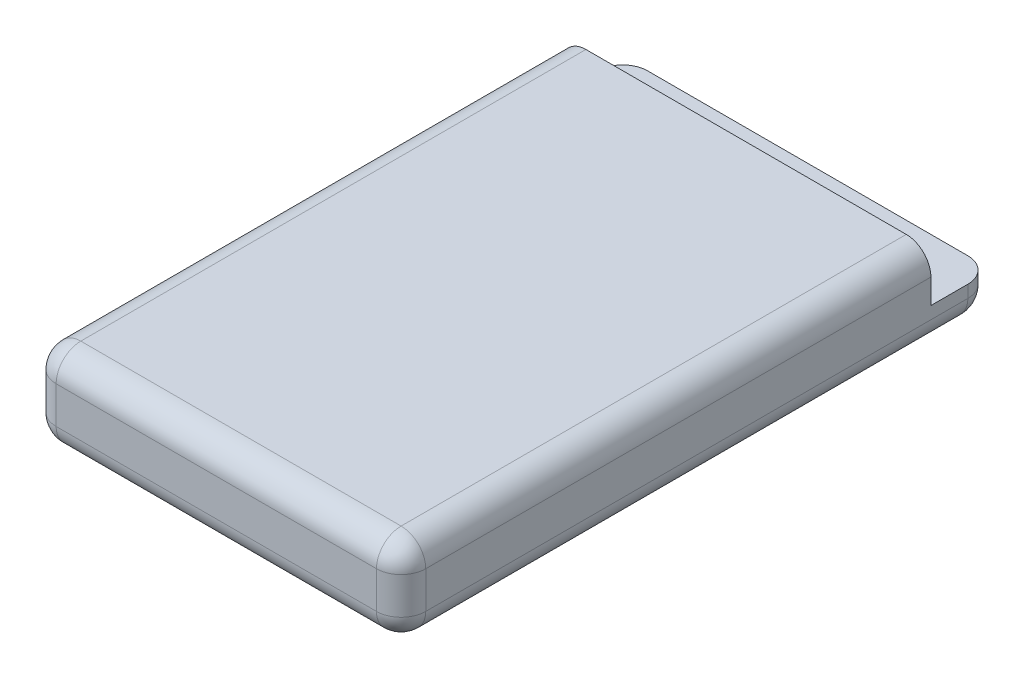
from build123d import *

# Parameters (mm, degrees)
SKETCH_1_W          = 30
SKETCH_1_H          = 48
EXTRUDE_1_DEPTH     = 7
FILLET_1_R          = 2
FILLET_2_R          = 2
SKETCH_2_W          = 26
SKETCH_2_H          = 3
CUT_EXTRUDE_1_DEPTH = 4


with BuildPart() as part:
    # Эскиз1 → Бобышка-Вытянуть1 (new body)
    with BuildSketch(Plane(origin=(0, 0, 0), x_dir=(1, 0, 0), z_dir=(0, 1, 0))):
        Rectangle(SKETCH_1_W, SKETCH_1_H)
    extrude(amount=EXTRUDE_1_DEPTH)

    # Скругление1
    fillet_1_edges = [part.edges().sort_by_distance(p)[0] for p in [
        (-15, 7, 0),
        (0, 7, 24),
        (15, 7, 0),
        (0, 0, 24),
        (-15, 0, 0),
        (0, 0, -24),
        (15, 0, 0),
        (0, 7, -24),
    ]]
    fillet(fillet_1_edges, radius=FILLET_1_R)

    # Скругление2
    # the kernel refuses this fillet: 2 mm, written as the material it takes off along each edge
    with BuildSketch(Plane(origin=(13, 2, 22), x_dir=(1, 0, 0), z_dir=(0, 0, 1))) as fillet_2_piece_1_section:
        Polygon((0, 0), (FILLET_2_R, 0), (FILLET_2_R, -FILLET_2_R), (0, -FILLET_2_R), align=None)
    fillet_2_piece_1 = extrude(amount=FILLET_2_R, mode=Mode.PRIVATE)
    fillet_2_piece_1 = fillet_2_piece_1 - Plane(origin=(13, 2, 22), x_dir=(-0.7071067811865475, 0.7071067811865475, 0), z_dir=(0, 0, 1)) * Sphere(FILLET_2_R, mode=Mode.PRIVATE)
    add(fillet_2_piece_1, mode=Mode.SUBTRACT)
    with BuildSketch(Plane(origin=(-13, 2, 22), x_dir=(-1, 0, 0), z_dir=(0, 0, 1))) as fillet_2_piece_2_section:
        Polygon((0, 0), (FILLET_2_R, 0), (FILLET_2_R, FILLET_2_R), (0, FILLET_2_R), align=None)
    fillet_2_piece_2 = extrude(amount=FILLET_2_R, mode=Mode.PRIVATE)
    fillet_2_piece_2 = fillet_2_piece_2 - Plane(origin=(-13, 2, 22), x_dir=(0.7071067811865475, 0.7071067811865475, 0), z_dir=(0, 0, 1)) * Sphere(FILLET_2_R, mode=Mode.PRIVATE)
    add(fillet_2_piece_2, mode=Mode.SUBTRACT)
    with BuildSketch(Plane(origin=(13, 2, -22), x_dir=(0, 0, -1), z_dir=(1, 0, 0))) as fillet_2_piece_3_section:
        Polygon((0, 0), (FILLET_2_R, 0), (FILLET_2_R, -FILLET_2_R), (0, -FILLET_2_R), align=None)
    fillet_2_piece_3 = extrude(amount=FILLET_2_R, mode=Mode.PRIVATE)
    fillet_2_piece_3 = fillet_2_piece_3 - Plane(origin=(13, 2, -22), x_dir=(0, 0.7071067811865475, 0.7071067811865475), z_dir=(1, 0, 0)) * Sphere(FILLET_2_R, mode=Mode.PRIVATE)
    add(fillet_2_piece_3, mode=Mode.SUBTRACT)
    with BuildSketch(Plane(origin=(-13, 2, -22), x_dir=(0, 0, -1), z_dir=(-1, 0, 0))) as fillet_2_piece_4_section:
        Polygon((0, 0), (FILLET_2_R, 0), (FILLET_2_R, FILLET_2_R), (0, FILLET_2_R), align=None)
    fillet_2_piece_4 = extrude(amount=FILLET_2_R, mode=Mode.PRIVATE)
    fillet_2_piece_4 = fillet_2_piece_4 - Plane(origin=(-13, 2, -22), x_dir=(0, 0.7071067811865475, 0.7071067811865475), z_dir=(-1, 0, 0)) * Sphere(FILLET_2_R, mode=Mode.PRIVATE)
    add(fillet_2_piece_4, mode=Mode.SUBTRACT)
    with BuildSketch(Plane(origin=(-13, 5, -22), x_dir=(0, 0, -1), z_dir=(-1, 0, 0))) as fillet_2_piece_5_section:
        Polygon((0, 0), (FILLET_2_R, 0), (FILLET_2_R, -FILLET_2_R), (0, -FILLET_2_R), align=None)
    fillet_2_piece_5 = extrude(amount=FILLET_2_R, mode=Mode.PRIVATE)
    fillet_2_piece_5 = fillet_2_piece_5 - Plane(origin=(-13, 5, -22), x_dir=(0, -0.7071067811865475, 0.7071067811865475), z_dir=(-1, 0, 0)) * Sphere(FILLET_2_R, mode=Mode.PRIVATE)
    add(fillet_2_piece_5, mode=Mode.SUBTRACT)
    with BuildSketch(Plane(origin=(13, 5, -22), x_dir=(0, 0, -1), z_dir=(1, 0, 0))) as fillet_2_piece_6_section:
        Polygon((0, 0), (FILLET_2_R, 0), (FILLET_2_R, FILLET_2_R), (0, FILLET_2_R), align=None)
    fillet_2_piece_6 = extrude(amount=FILLET_2_R, mode=Mode.PRIVATE)
    fillet_2_piece_6 = fillet_2_piece_6 - Plane(origin=(13, 5, -22), x_dir=(0, -0.7071067811865475, 0.7071067811865475), z_dir=(1, 0, 0)) * Sphere(FILLET_2_R, mode=Mode.PRIVATE)
    add(fillet_2_piece_6, mode=Mode.SUBTRACT)
    with BuildSketch(Plane(origin=(-13, 5, 22), x_dir=(-1, 0, 0), z_dir=(0, 0, 1))) as fillet_2_piece_7_section:
        Polygon((0, 0), (FILLET_2_R, 0), (FILLET_2_R, -FILLET_2_R), (0, -FILLET_2_R), align=None)
    fillet_2_piece_7 = extrude(amount=FILLET_2_R, mode=Mode.PRIVATE)
    fillet_2_piece_7 = fillet_2_piece_7 - Plane(origin=(-13, 5, 22), x_dir=(0.7071067811865475, -0.7071067811865475, 0), z_dir=(0, 0, 1)) * Sphere(FILLET_2_R, mode=Mode.PRIVATE)
    add(fillet_2_piece_7, mode=Mode.SUBTRACT)
    with BuildSketch(Plane(origin=(13, 5, 22), x_dir=(1, 0, 0), z_dir=(0, 0, 1))) as fillet_2_piece_8_section:
        Polygon((0, 0), (FILLET_2_R, 0), (FILLET_2_R, FILLET_2_R), (0, FILLET_2_R), align=None)
    fillet_2_piece_8 = extrude(amount=FILLET_2_R, mode=Mode.PRIVATE)
    fillet_2_piece_8 = fillet_2_piece_8 - Plane(origin=(13, 5, 22), x_dir=(-0.7071067811865475, -0.7071067811865475, 0), z_dir=(0, 0, 1)) * Sphere(FILLET_2_R, mode=Mode.PRIVATE)
    add(fillet_2_piece_8, mode=Mode.SUBTRACT)
    with BuildSketch(Plane(origin=(-15, 2, -24), x_dir=(0, 0, 1), z_dir=(0, 1, 0)), Plane(origin=(-15, 2, 24), x_dir=(1, 0, 0), z_dir=(0, 1, 0))) as fillet_2_piece_9:
        with BuildLine():
            CenterArc((FILLET_2_R, FILLET_2_R), FILLET_2_R, 180, 90)
            Line((0, FILLET_2_R), (0, 0))
            Line((0, 0), (FILLET_2_R, 0))
        make_face()
    extrude(amount=3, mode=Mode.SUBTRACT)
    with BuildSketch(Plane(origin=(15, 2, -24), x_dir=(0, 0, 1), z_dir=(0, 1, 0)), Plane(origin=(15, 2, 24), x_dir=(-1, 0, 0), z_dir=(0, 1, 0))) as fillet_2_piece_10:
        with BuildLine():
            CenterArc((FILLET_2_R, -FILLET_2_R), FILLET_2_R, 90, 90)
            Line((0, -FILLET_2_R), (0, 0))
            Line((0, 0), (FILLET_2_R, 0))
        make_face()
    extrude(amount=3, mode=Mode.SUBTRACT)

    # Эскиз2 → Вырез-Вытянуть1 (cut)
    with BuildSketch(Plane(origin=(0, 7, 0), x_dir=(1, 0, 0), z_dir=(0, 1, 0))):
        with Locations((0, 20.5)):
            Rectangle(SKETCH_2_W, SKETCH_2_H)
        Polygon((-13, 24), (-15.574798144, 24), (-15.574798144, 19), (-13, 19), (-13, 22), (13, 22), (13, 19), (18.278986273, 19), (18.278986273, 24), (13, 24), align=None)
    extrude(amount=-CUT_EXTRUDE_1_DEPTH, mode=Mode.SUBTRACT)


solid = part.part
